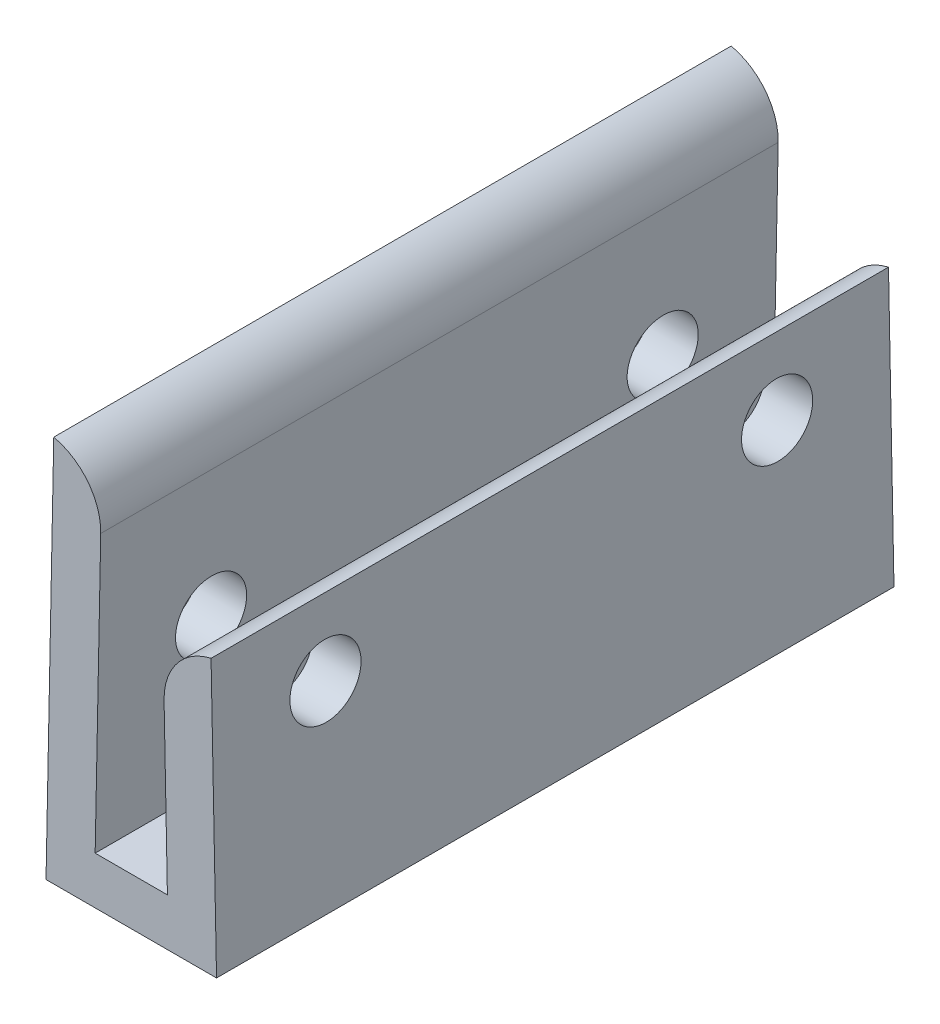
from build123d import *

# Parameters (mm, degrees)
BOSS_EXTRUDE1_DEPTH = 28.575
CUT_EXTRUDE1_REACH  = 35.651
SKETCH2_R           = 1.5
CUT_EXTRUDE2_REACH  = 35.651
SKETCH3_R           = 1.5
FILLET1_R           = 2.54


with BuildPart() as part:
    # Sketch1 → Boss-Extrude1 (new body)
    with BuildSketch(Plane.XY):
        Polygon((-1.3335, 11.523094809), (-3.365093559, 11.563734809), (-3.596414524, 0), (3.596414524, 0), (3.365093559, 11.563734809), (1.3335, 11.523094809), (1.524, 2), (-1.524, 2), align=None)
        Polygon((-1.23825, 16.284642214), (-1.3335, 11.523094809), (-3.365093559, 11.563734809), (-3.269843559, 16.325282214), align=None)
    extrude(amount=BOSS_EXTRUDE1_DEPTH)

    # Sketch2 → Cut-Extrude1 (cut, up to next)
    with BuildSketch(Plane(origin=(3.594975959, 0.071913903, 0), x_dir=(0, 0, -1), z_dir=(0.9997999799959991, 0.01999999999999963, 0)), mode=Mode.PRIVATE) as cut_extrude1_sk1:
        with Locations(Location((-23.8125, 8.31911996, 0), (0, 0, 90))):
            Circle(SKETCH2_R)
    cut_extrude1_tool1 = extrude(cut_extrude1_sk1.sketch, amount=-CUT_EXTRUDE1_REACH, mode=Mode.PRIVATE) & part.part
    # Sketch2 → Cut-Extrude1 (cut, up to next)
    with BuildSketch(Plane(origin=(3.594975959, 0.071913903, 0), x_dir=(0, 0, -1), z_dir=(0.9997999799959991, 0.01999999999999963, 0)), mode=Mode.PRIVATE) as cut_extrude1_sk2:
        with Locations(Location((-4.7625, 8.31911996, 0), (0, 0, 90))):
            Circle(SKETCH2_R)
    cut_extrude1_tool2 = extrude(cut_extrude1_sk2.sketch, amount=-CUT_EXTRUDE1_REACH, mode=Mode.PRIVATE) & part.part
    add(cut_extrude1_tool1.solids().sort_by_distance((3.428594, 8.38937, 23.8125))[0], mode=Mode.SUBTRACT)
    add(cut_extrude1_tool2.solids().sort_by_distance((3.428594, 8.38937, 4.7625))[0], mode=Mode.SUBTRACT)

    # Sketch3 → Cut-Extrude2 (cut, up to next)
    with BuildSketch(Plane(origin=(-3.594975959, 0.071913903, 0), x_dir=(0, 0, 1), z_dir=(-0.9997999799959991, 0.019999999999999622, 0)), mode=Mode.PRIVATE) as cut_extrude2_sk1:
        with Locations(Location((4.7625, 8.29879996, 0), (0, 0, 270))):
            Circle(SKETCH3_R)
    cut_extrude2_tool1 = extrude(cut_extrude2_sk1.sketch, amount=-CUT_EXTRUDE2_REACH, mode=Mode.PRIVATE) & part.part
    # Sketch3 → Cut-Extrude2 (cut, up to next)
    with BuildSketch(Plane(origin=(-3.594975959, 0.071913903, 0), x_dir=(0, 0, 1), z_dir=(-0.9997999799959991, 0.019999999999999622, 0)), mode=Mode.PRIVATE) as cut_extrude2_sk2:
        with Locations(Location((23.8125, 8.29879996, 0), (0, 0, 270))):
            Circle(SKETCH3_R)
    cut_extrude2_tool2 = extrude(cut_extrude2_sk2.sketch, amount=-CUT_EXTRUDE2_REACH, mode=Mode.PRIVATE) & part.part
    add(cut_extrude2_tool1.solids().sort_by_distance((-3.429, 8.369054, 4.7625))[0], mode=Mode.SUBTRACT)
    add(cut_extrude2_tool2.solids().sort_by_distance((-3.429, 8.369054, 23.8125))[0], mode=Mode.SUBTRACT)

    # Fillet1
    # the kernel refuses this fillet: 2.54 mm, written as the material it takes off along each edge
    with BuildSketch(Plane(origin=(1.3335, 11.523094809, -6.221703947), x_dir=(0.9997999799960309, 0.019999999998416385, 0), z_dir=(0, 0, 1))) as fillet1_piece_1:
        with BuildLine():
            CenterArc((2.54, -2.488681579), FILLET1_R, 101.536959033, 78.463040967)
            Line((0, -2.488681579), (-0.0508, -2.488681579))
            Line((-0.0508, -2.488681579), (-0.0508, 0))
            Line((-0.0508, 0), (0, 0.0508))
            ThreePointArc((0, 0.0508), (1.016, 0.0508), (2.02184, 0.049773632))
            Line((2.02184, 0.049773632), (2.032, 0))
        make_face()
    extrude(amount=41.018407893, mode=Mode.SUBTRACT)
    with BuildSketch(Plane(origin=(-1.23825, 16.284642214, -6.221703947), x_dir=(-0.9997999799960307, 0.019999999998425156, 0), z_dir=(0, 0, 1))) as fillet1_piece_2:
        with BuildLine():
            CenterArc((2.54, 2.488681579), FILLET1_R, 180, 78.463040967)
            Line((0, 2.488681579), (-0.0508, 2.488681579))
            Line((-0.0508, 2.488681579), (-0.0508, 0))
            Line((-0.0508, 0), (0, -0.0508))
            ThreePointArc((0, -0.0508), (1.016, -0.0508), (2.02184, -0.049773632))
            Line((2.02184, -0.049773632), (2.032, 0))
        make_face()
    extrude(amount=41.018407893, mode=Mode.SUBTRACT)


solid = part.part
